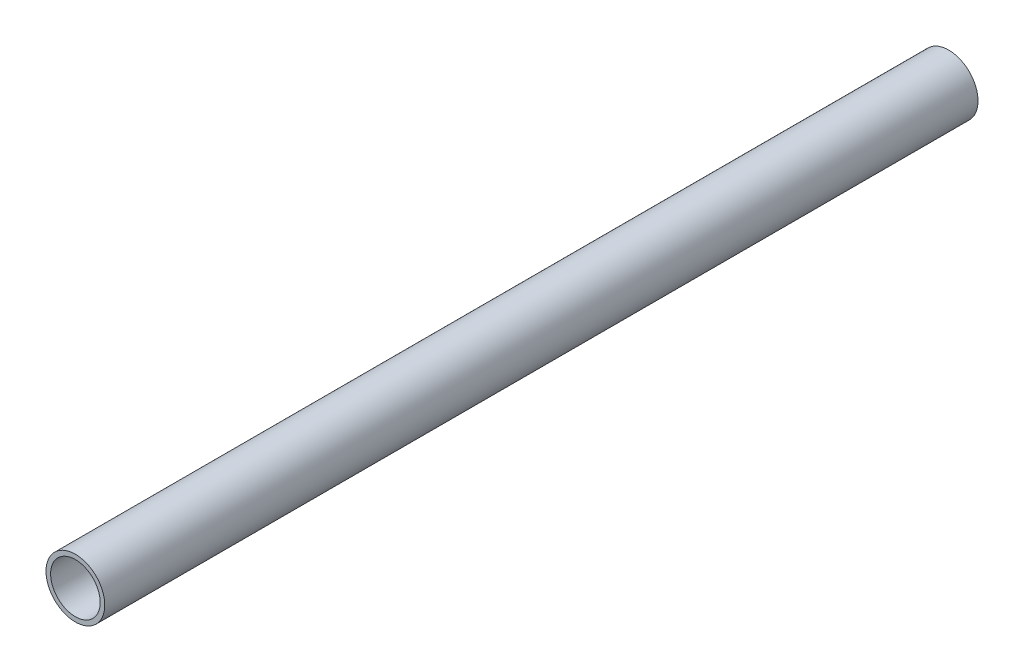
from build123d import *

# Parameters (mm, degrees)
SKETCH3_R           = 7.9375
SKETCH3_R_2         = 6.6929
BOSS_EXTRUDE1_DEPTH = 117.965596936


with BuildPart() as part:
    # Sketch3 → Boss-Extrude1 (new, symmetric)
    with BuildSketch(Plane.XY):
        Circle(SKETCH3_R)
        Circle(SKETCH3_R_2, mode=Mode.SUBTRACT)
    extrude(amount=BOSS_EXTRUDE1_DEPTH, both=True)


solid = part.part
